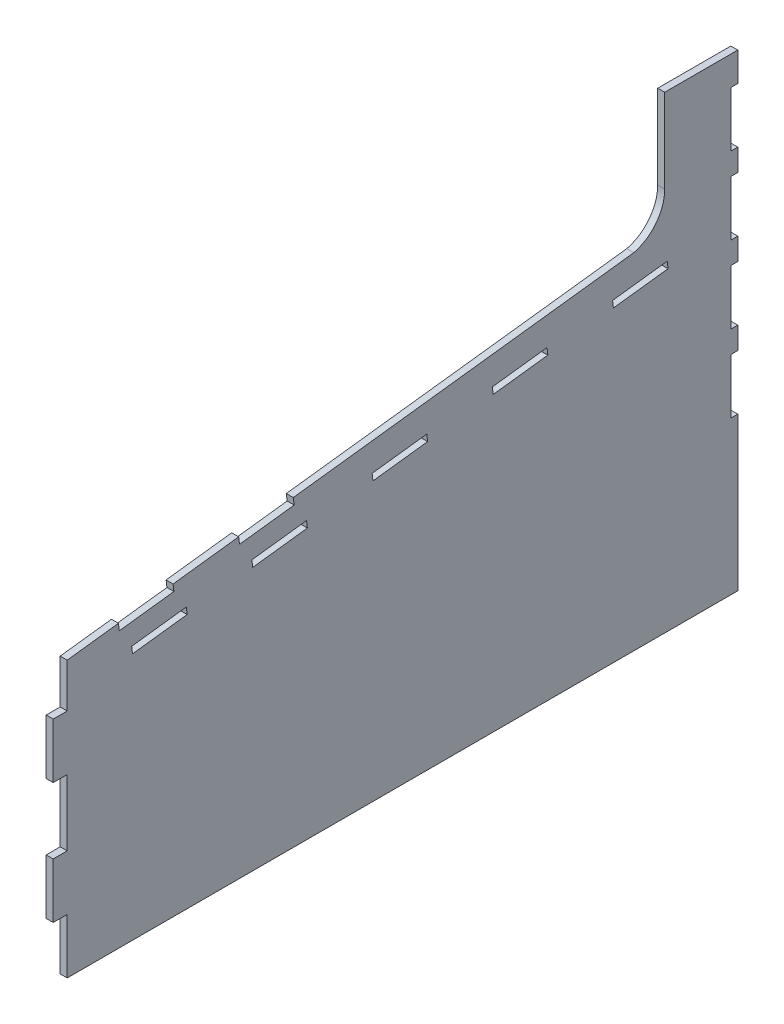
from build123d import *

# Parameters (mm, degrees)
BOSS_EXTRUDE1_DEPTH = 6.35
CUT_EXTRUDE1_DEPTH  = 6.35


with BuildPart() as part:
    # Sketch1 → Boss-Extrude1 (new body)
    with BuildSketch(Plane(origin=(0, 0, 0), x_dir=(0, 0, -1), z_dir=(1, 0, 0))):
        with BuildLine():
            Line((0, 0), (609, 0))
            Line((609, 0), (609, 138.97))
            Line((609, 138.97), (602.65, 138.97))
            Line((602.65, 138.97), (602.65, 188.97))
            Line((602.65, 188.97), (609, 188.97))
            Line((609, 188.97), (609, 208.97))
            Line((609, 208.97), (602.65, 208.97))
            Line((602.65, 208.97), (602.65, 258.97))
            Line((602.65, 258.97), (609, 258.97))
            Line((609, 258.97), (609, 278.97))
            Line((609, 278.97), (602.65, 278.97))
            Line((602.65, 278.97), (602.65, 328.97))
            Line((602.65, 328.97), (609, 328.97))
            Line((609, 328.97), (609, 348.97))
            Line((609, 348.97), (602.65, 348.97))
            Line((602.65, 348.97), (602.65, 398.97))
            Line((602.65, 398.97), (609, 398.97))
            Line((609, 398.97), (609, 425.32))
            Line((609, 425.32), (542.65, 425.32))
            Line((542.65, 425.32), (542.65, 349.09))
            ThreePointArc((542.65, 349.09), (534.796363904, 326.297688332), (514.569488044, 313.181188643))
            Line((514.569488044, 313.181188643), (0, 250))
            Line((0, 250), (0, 210))
            Line((0, 210), (-12.7, 210))
            Line((-12.7, 210), (-12.7, 160))
            Line((-12.7, 160), (0, 160))
            Line((0, 160), (0, 100))
            Line((0, 100), (-12.7, 100))
            Line((-12.7, 100), (-12.7, 50))
            Line((-12.7, 50), (0, 50))
            Line((0, 50), (0, 0))
        make_face()
    extrude(amount=BOSS_EXTRUDE1_DEPTH)

    # Sketch2 → Cut-Extrude1 (cut)
    with BuildSketch(Plane(origin=(6.35, 0, 0), x_dir=(0, 0, -1), z_dir=(1, 0, 0))):
        Polygon((205.339210522, 275.2124848), (155.71190294, 269.11901763), (156.485773271, 262.816349567), (206.113080853, 268.909816737), align=None)
        Polygon((58.560222947, 231.599541694), (59.334093277, 225.296873631), (108.96140086, 231.390340802), (108.187530529, 237.693008865), align=None)
        Polygon((217.367607209, 251.098636639), (167.740299627, 245.005169469), (168.514169958, 238.702501406), (218.14147754, 244.795968576), align=None)
        Polygon((326.54768389, 264.504264414), (276.920376308, 258.410797243), (277.694246639, 252.10812918), (327.321554221, 258.201596351), align=None)
        Polygon((435.727760571, 277.909892188), (386.100452988, 271.816425018), (386.874323319, 265.513756955), (436.501630901, 271.607224125), align=None)
        Polygon((544.907837251, 291.315519963), (495.280529669, 285.222052793), (496.0544, 278.91938473), (545.681707582, 285.0128519), align=None)
        Polygon((46.53182626, 255.713389855), (47.30569659, 249.410721792), (96.933004172, 255.504188963), (96.159133842, 261.806857026), align=None)
    extrude(amount=-CUT_EXTRUDE1_DEPTH, mode=Mode.SUBTRACT)


solid = part.part
